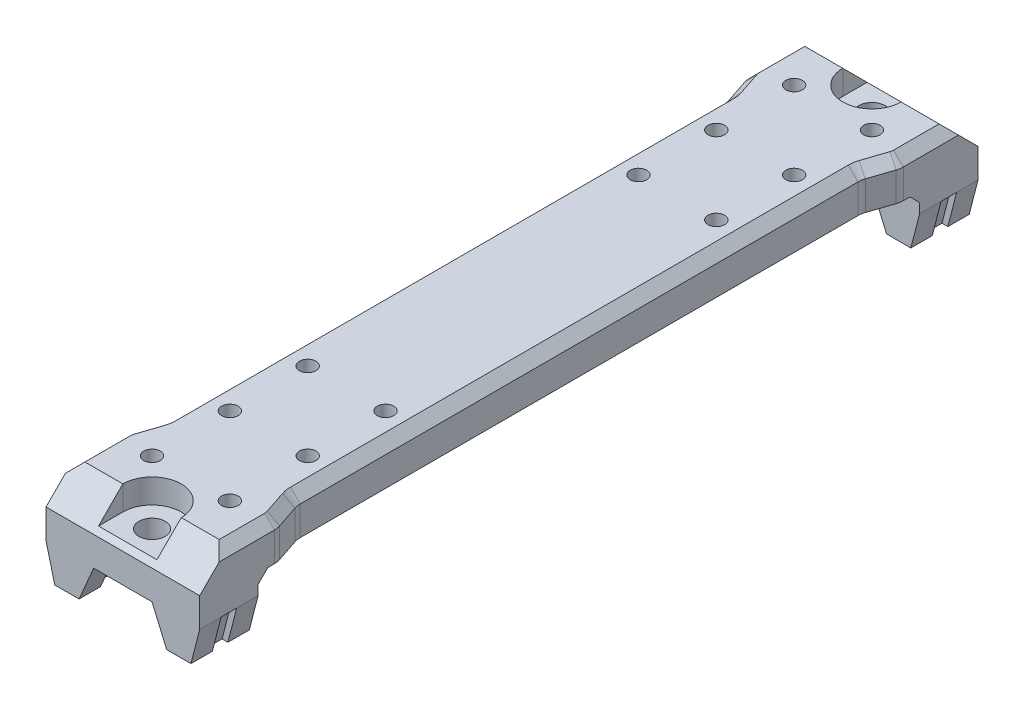
from build123d import *
from build123d.topology import SkipClean

# Parameters (mm, degrees)
EXTRUDE_1_DEPTH        = 4
EXTRUDE_3_DEPTH        = 6
CHAMFER_1_SIZE         = 3
SKETCH_5_R             = 0.85
CUT_EXTRUDE_1_DEPTH    = 4
PATTERN_LINEAR_1_COUNT = 4
PATTERN_LINEAR_1_PITCH = 8
CUT_EXTRUDE_2_DEPTH    = 2.5
CUT_EXTRUDE_3_REACH    = 41.439
SKETCH_7_R             = 1.35
SKETCH_8_R             = 6
EXTRUDE_4_DEPTH        = 1.5
FILLET_1_R             = 0.5
SKETCH_9_R             = 5
CUT_EXTRUDE_4_DEPTH    = 3.6
SKETCH_10_R            = 3.55
CUT_EXTRUDE_5_DEPTH    = 3.6
CUT_EXTRUDE_6_DEPTH    = 0.8
CUT_EXTRUDE_7_DEPTH    = 40.958228189
FILLET_2_R             = 2
CHAMFER_2_SIZE         = 1
EXTRUDE_5_DEPTH        = 10


with BuildPart() as part:
    # ｽｹｯﾁ1 → ﾎﾞｽ - 押し出し1 (new body)
    with BuildSketch(Plane(origin=(0, 0, 0), x_dir=(1, 0, 0), z_dir=(0, 1, 0))):
        with BuildLine():
            Line((-7.9, 0), (-7.9, -38))
            Line((-7.9, -38), (7.9, -38))
            Line((7.9, -38), (7.9, 0))
            ThreePointArc((7.9, 0), (0, 7.9), (-7.9, 0))
        make_face()
    extrude(amount=EXTRUDE_1_DEPTH)

    # ｽｹｯﾁ4 → ﾎﾞｽ - 押し出し3 (add)
    with BuildSketch(Plane.XY.offset(38)):
        Polygon((-7, -5.5), (-4.5, -5.5), (-3, -2), (3, -2), (4.5, -5.5), (7, -5.5), (7.9, -2), (7.9, 0), (-7.9, 0), (-7.9, -2), align=None)
    extrude(amount=-EXTRUDE_3_DEPTH)

    # 面取り1
    chamfer_1_edges = [part.edges().sort_by_distance(p)[0] for p in [
        (0, 4, 38),
    ]]
    chamfer(chamfer_1_edges, length=CHAMFER_1_SIZE)

    # ｽｹｯﾁ5 → ｶｯﾄ - 押し出し1 (cut)
    with BuildSketch(Plane(origin=(0, 4, 0), x_dir=(1, 0, 0), z_dir=(0, 1, 0))):
        with Locations(Location((-4, -31, 0), (0, 0, 270))):
            Circle(SKETCH_5_R)
        with Locations(Location((4, -31, 0), (0, 0, 270))):
            Circle(SKETCH_5_R)
    cut_extrude_1 = extrude(amount=-CUT_EXTRUDE_1_DEPTH, mode=Mode.SUBTRACT)

    # 直線ﾊﾟﾀｰﾝ1: ｶｯﾄ - 押し出し1 ×4
    with Locations(*[(0, 0, -i * PATTERN_LINEAR_1_PITCH) for i in range(1, PATTERN_LINEAR_1_COUNT)]):
        add(cut_extrude_1, mode=Mode.SUBTRACT)

    # ｽｹｯﾁ6 → ｶｯﾄ - 押し出し2 (cut)
    with BuildSketch(Plane(origin=(0, 4, 0), x_dir=(1, 0, 0), z_dir=(0, 1, 0))):
        with BuildLine():
            Line((-3, -35), (-3, -39))
            Line((-3, -39), (3, -39))
            Line((3, -39), (3, -35))
            ThreePointArc((3, -35), (0, -32), (-3, -35))
        make_face()
    extrude(amount=-CUT_EXTRUDE_2_DEPTH, mode=Mode.SUBTRACT)

    # ｽｹｯﾁ7 → ｶｯﾄ - 押し出し3 (cut, up to next)
    with BuildSketch(Plane(origin=(0, 1.5, 0), x_dir=(1, 0, 0), z_dir=(0, 1, 0)), mode=Mode.PRIVATE) as cut_extrude_3_sk1:
        with Locations(Location((0, -35, 0), (0, 0, 270))):
            Circle(SKETCH_7_R)
    cut_extrude_3_tool1 = extrude(cut_extrude_3_sk1.sketch, amount=-CUT_EXTRUDE_3_REACH, mode=Mode.PRIVATE) & part.part
    add(cut_extrude_3_tool1.solids().sort_by_distance((0, 1.5, 35))[0], mode=Mode.SUBTRACT)

    # ｽｹｯﾁ8 → ﾎﾞｽ - 押し出し4 (add)
    with BuildSketch(Plane.XZ):
        with Locations(Location((0, 0, 0), (0, 0, 90))):
            Circle(SKETCH_8_R)
    extrude(amount=EXTRUDE_4_DEPTH)

    # ﾌｨﾚｯﾄ1
    fillet_1_edges = [part.edges().sort_by_distance(p)[0] for p in [
        (0, 0, -6),
    ]]
    fillet(fillet_1_edges, radius=FILLET_1_R)

    # ｽｹｯﾁ9 → ｶｯﾄ - 押し出し4 (cut)
    with BuildSketch(Plane(origin=(0, 4, 0), x_dir=(1, 0, 0), z_dir=(0, 1, 0))):
        with Locations(Location((0, 0, 0), (0, 0, 270))):
            Circle(SKETCH_9_R)
    extrude(amount=-CUT_EXTRUDE_4_DEPTH, mode=Mode.SUBTRACT)

    # ｽｹｯﾁ10 → ｶｯﾄ - 押し出し5 (cut)
    with BuildSketch(Plane(origin=(0, 0.4, 0), x_dir=(1, 0, 0), z_dir=(0, 1, 0))):
        with Locations(Location((0, 0, 0), (0, 0, 270))):
            Circle(SKETCH_10_R)
    extrude(amount=-CUT_EXTRUDE_5_DEPTH, mode=Mode.SUBTRACT)

    # ｽｹｯﾁ11 → ｶｯﾄ - 押し出し6 (cut, symmetric)
    with BuildSketch(Plane.XY.offset(35)):
        Polygon((3, -2), (4.5, -5.5), (5.1, -5.5), (3.6, -2), align=None)
        Polygon((7.9, -2), (7, -5.5), (6.4, -5.5), (7.3, -2), align=None)
    cut_extrude_6 = extrude(amount=CUT_EXTRUDE_6_DEPTH, both=True, mode=Mode.SUBTRACT)

    # ﾐﾗｰ1: ｶｯﾄ - 押し出し6 across plane
    add(cut_extrude_6.mirror(Plane(origin=(0, 0, 0), x_dir=(0, 0, 1), z_dir=(1, 0, 0))), mode=Mode.SUBTRACT)

    # ｽｹｯﾁ12 → ｶｯﾄ - 押し出し7 (cut, through all)
    with SkipClean():  # the faces are left unmerged after this step: merging them gives an invalid solid
        with BuildSketch(Plane(origin=(0, 4, 0), x_dir=(1, 0, 0), z_dir=(0, 1, 0))):
            with BuildLine():
                Line((-7.9, 0), (-7.9, -30))
                Line((-7.9, -30), (-6.9, -27))
                Line((-6.9, -27), (-6.9, -3.847076812))
                ThreePointArc((-6.9, -3.847076812), (-7.645913941, -1.987460691), (-7.9, 0))
            make_face()
        cut_extrude_7 = extrude(amount=-CUT_EXTRUDE_7_DEPTH, mode=Mode.SUBTRACT)

    # ﾐﾗｰ2: ｶｯﾄ - 押し出し7 across plane
    with SkipClean():  # the faces are left unmerged after this step: merging them gives an invalid solid
        add(cut_extrude_7.mirror(Plane(origin=(0, 0, 0), x_dir=(0, 0, 1), z_dir=(1, 0, 0))), mode=Mode.SUBTRACT)

    # ﾌｨﾚｯﾄ2
    fillet_2_edges = [part.edges().sort_by_distance(p)[0] for p in [
        (-6.9, 2, 3.847076812),
        (-6.9, 2, 27),
        (-7.9, 2, 30),
        (6.9, 2, 3.847076812),
        (7.9, 2, 30),
        (6.9, 2, 27),
    ]]
    fillet(fillet_2_edges, radius=FILLET_2_R)

    # 面取り2
    # the kernel refuses this chamfer: 1 mm, written as the material it adds along each edge
    with BuildSketch(Plane(origin=(7.9, 0, 32), x_dir=(0, 0.02749587661058639, -0.9996219169112968), z_dir=(-1, 0, 0))) as chamfer_2_piece_1_section:
        Polygon((CHAMFER_2_SIZE * 0.999621916911, CHAMFER_2_SIZE * 0.0274958766106), (-CHAMFER_2_SIZE * 0.0274958766106, CHAMFER_2_SIZE * 0.999621916911), (0, 0), align=None)
    chamfer_2_piece_1 = extrude(amount=15.8, mode=Mode.PRIVATE)
    chamfer_2_piece_1 = chamfer_2_piece_1 - Plane(origin=(-4, -0.34097177, 31), x_dir=(0, 0, 1), z_dir=(0, 1, 0)) * Cylinder(0.85, 36, mode=Mode.PRIVATE)
    chamfer_2_piece_1 = chamfer_2_piece_1 - Plane(origin=(4, -0.34097177, 31), x_dir=(0, 0, 1), z_dir=(0, 1, 0)) * Cylinder(0.85, 36, mode=Mode.PRIVATE)
    add(chamfer_2_piece_1)
    # the kernel refuses this chamfer: 1 mm, written as the material it takes off along each edge
    with BuildSketch(Plane(origin=(-7.9, 4, 30.32455532), x_dir=(-0.027495876610586487, -0.9996219169112968, 0), z_dir=(0, 0, 1)), Plane(origin=(7.9, 4, 37.571682988), x_dir=(0.027495876610586487, -0.9996219169112968, 0), z_dir=(0, 0, -1))) as chamfer_2_2_piece_1:
        Polygon((CHAMFER_2_SIZE * 0.999621916911, CHAMFER_2_SIZE * 0.0274958766106), (-CHAMFER_2_SIZE * 0.0274958766106, CHAMFER_2_SIZE * 0.999621916911), (0, 0), align=None)
    extrude(amount=7.247127668, mode=Mode.SUBTRACT)
    with BuildSketch(Plane(origin=(0, 4, 0), x_dir=(1, 0, 0), z_dir=(0, 0, 1))) as chamfer_2_2_piece_2:
        Polygon((7.9, -CHAMFER_2_SIZE), (7.9 - CHAMFER_2_SIZE, 0), (7.9, 0), align=None)
    revolve(axis=Axis((0, 4, 0), (0, 1, 0)), revolution_arc=180, mode=Mode.SUBTRACT)
    with BuildSketch(Plane(origin=(-5.9, 4, 30.32455532), x_dir=(-1, 0, 0), z_dir=(0, 0, 1))) as chamfer_2_2_piece_3:
        Polygon((2, CHAMFER_2_SIZE), (2 - CHAMFER_2_SIZE, 0), (2, 0), align=None)
    revolve(axis=Axis((-5.9, 4, 30.32455532), (0, -1, 0)), revolution_arc=18.434948823, mode=Mode.SUBTRACT)
    with BuildSketch(Plane(origin=(-7.797366596, 4, 29.692099788), x_dir=(-0.02608487890572092, -0.9996219169112968, -0.008694959635240314), z_dir=(0.3162277660168382, 0, -0.9486832980505138))) as chamfer_2_2_piece_4:
        Polygon((CHAMFER_2_SIZE * 0.999621916911, -CHAMFER_2_SIZE * 0.0274958766106), (-CHAMFER_2_SIZE * 0.0274958766106, -CHAMFER_2_SIZE * 0.999621916911), (0, 0), align=None)
    extrude(amount=2.513167019, mode=Mode.SUBTRACT)
    with BuildSketch(Plane(origin=(-8.9, 4, 26.67544468), x_dir=(0.9486832980505135, 0, 0.3162277660168389), z_dir=(-0.3162277660168389, 0, 0.9486832980505135))) as chamfer_2_2_piece_5:
        Polygon((2, -CHAMFER_2_SIZE), (2 + CHAMFER_2_SIZE, 0), (2, 0), align=None)
    revolve(axis=Axis((-8.9, 4, 26.67544468), (0, 1, 0)), revolution_arc=18.434948823, mode=Mode.SUBTRACT)
    with BuildSketch(Plane(origin=(-6.9, 4, 26.67544468), x_dir=(-0.027495876610586487, -0.9996219169112968, 0), z_dir=(0, 0, -1))) as chamfer_2_2_piece_6:
        Polygon((CHAMFER_2_SIZE * 0.999621916911, -CHAMFER_2_SIZE * 0.0274958766106), (-CHAMFER_2_SIZE * 0.0274958766106, -CHAMFER_2_SIZE * 0.999621916911), (0, 0), align=None)
    extrude(amount=22.339548002, mode=Mode.SUBTRACT)
    with BuildSketch(Plane(origin=(-8.9, 4, 4.335896678), x_dir=(1, 0, 0), z_dir=(0, 0, 1))) as chamfer_2_2_piece_7:
        Polygon((2, -CHAMFER_2_SIZE), (2 + CHAMFER_2_SIZE, 0), (2, 0), align=None)
    revolve(axis=Axis((-8.9, 4, 4.335896678), (0, 1, 0)), revolution_arc=25.974390018, mode=Mode.SUBTRACT)
    with BuildSketch(Plane(origin=(8.9, 4, 4.335896678), x_dir=(-0.8989898989898989, 0, -0.43796936138745074), z_dir=(0.43796936138745074, 0, -0.8989898989898989))) as chamfer_2_2_piece_8:
        Polygon((2, -CHAMFER_2_SIZE), (2 + CHAMFER_2_SIZE, 0), (2, 0), align=None)
    revolve(axis=Axis((8.9, 4, 4.335896678), (0, 1, 0)), revolution_arc=25.974390018, mode=Mode.SUBTRACT)
    with BuildSketch(Plane(origin=(6.9, 4, 26.67544468), x_dir=(0.027495876610586487, -0.9996219169112968, 0), z_dir=(0, 0, -1))) as chamfer_2_2_piece_9:
        Polygon((CHAMFER_2_SIZE * 0.999621916911, CHAMFER_2_SIZE * 0.0274958766106), (-CHAMFER_2_SIZE * 0.0274958766106, CHAMFER_2_SIZE * 0.999621916911), (0, 0), align=None)
    extrude(amount=22.339548002, mode=Mode.SUBTRACT)
    with BuildSketch(Plane(origin=(8.9, 4, 26.67544468), x_dir=(-1, 0, 0), z_dir=(0, 0, -1))) as chamfer_2_2_piece_10:
        Polygon((2, -CHAMFER_2_SIZE), (2 + CHAMFER_2_SIZE, 0), (2, 0), align=None)
    revolve(axis=Axis((8.9, 4, 26.67544468), (0, 1, 0)), revolution_arc=18.434948823, mode=Mode.SUBTRACT)
    with BuildSketch(Plane(origin=(7.797366596, 4, 29.692099788), x_dir=(0.02608487890572092, -0.9996219169112968, -0.008694959635240314), z_dir=(-0.3162277660168382, 0, -0.9486832980505138))) as chamfer_2_2_piece_11:
        Polygon((CHAMFER_2_SIZE * 0.999621916911, CHAMFER_2_SIZE * 0.0274958766106), (-CHAMFER_2_SIZE * 0.0274958766106, CHAMFER_2_SIZE * 0.999621916911), (0, 0), align=None)
    extrude(amount=2.513167019, mode=Mode.SUBTRACT)
    with BuildSketch(Plane(origin=(5.9, 4, 30.32455532), x_dir=(0.9486832980505135, 0, -0.3162277660168389), z_dir=(-0.3162277660168389, 0, -0.9486832980505135))) as chamfer_2_2_piece_12:
        Polygon((2, CHAMFER_2_SIZE), (2 - CHAMFER_2_SIZE, 0), (2, 0), align=None)
    revolve(axis=Axis((5.9, 4, 30.32455532), (0, -1, 0)), revolution_arc=18.434948823, mode=Mode.SUBTRACT)
    with BuildSketch(Plane(origin=(0, 4, 0), x_dir=(0.8989898989898987, 0, 0.43796936138745124), z_dir=(-0.43796936138745124, 0, 0.8989898989898987))) as chamfer_2_2_piece_13:
        Polygon((7.9, -CHAMFER_2_SIZE), (7.9 - CHAMFER_2_SIZE, 0), (7.9, 0), align=None)
    revolve(axis=Axis((0, 4, 0), (0, 1, 0)), revolution_arc=25.974390018, mode=Mode.SUBTRACT)
    with BuildSketch(Plane(origin=(0, 4, 0), x_dir=(-0.8989898989898987, 0, 0.43796936138745124), z_dir=(0.43796936138745124, 0, 0.8989898989898987))) as chamfer_2_2_piece_14:
        Polygon((7.9, CHAMFER_2_SIZE), (7.9 - CHAMFER_2_SIZE, 0), (7.9, 0), align=None)
    revolve(axis=Axis((0, 4, 0), (0, -1, 0)), revolution_arc=25.974390018, mode=Mode.SUBTRACT)

    # Split Bodies 1
    split(bisect_by=Plane.XY.offset(8), keep=Keep.TOP)

    # ｽｹｯﾁ14 → ﾎﾞｽ - 押し出し5 (add)
    with BuildSketch(Plane(origin=(0, 0, 8), x_dir=(-1, 0, 0), z_dir=(0, 0, -1))):
        Polygon((6.9, 0), (-6.9, 0), (-6.9, 3), (-5.9, 4), (5.9, 4), (6.9, 3), align=None)
    extrude(amount=EXTRUDE_5_DEPTH)

    # ﾐﾗｰ3: part across plane


with BuildPart() as part_1:
    add(part.part)
    add(part.part.mirror(Plane(origin=(0, 0, -2), x_dir=(1, 0, 0), z_dir=(0, 0, -1))))


solid = part_1.part
